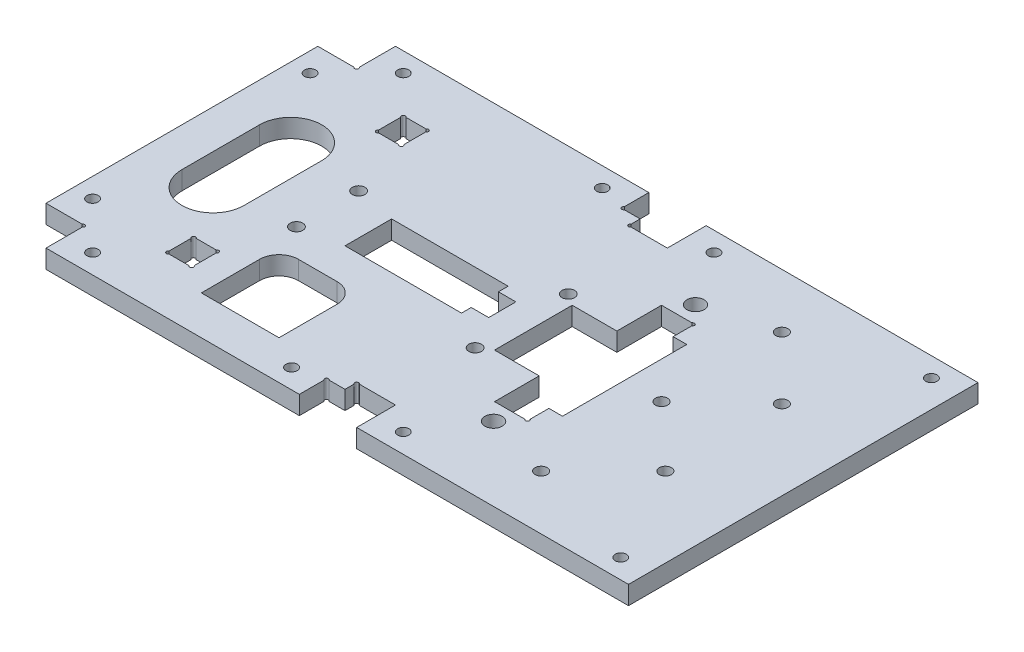
from build123d import *

# Parameters (mm, degrees)
BOSS_EXTRUDE1_DEPTH = 4.7625
MIRROR1_START       = -80
MIRROR1_OUTLINE_W   = 4.7625
MIRROR1_OUTLINE_H   = 35
MIRROR1_DEPTH       = 160
MIRROR1_START_2     = 10
MIRROR1_2_OUTLINE_W = 4.7625
MIRROR1_2_OUTLINE_H = 10
MIRROR1_2_DEPTH     = 70
MIRROR1_START_3     = -70
MIRROR1_3_OUTLINE_W = 4.7625
MIRROR1_3_OUTLINE_H = 10
MIRROR1_3_DEPTH     = 65.2375
MIRROR1_START_4     = -4.7625
MIRROR1_4_OUTLINE_W = 4.7625
MIRROR1_4_OUTLINE_H = 3
MIRROR1_4_DEPTH     = 4.7625
SKETCH2_R           = 1.625
SKETCH2_W           = 14
SKETCH2_H           = 3
SKETCH2_W_2         = 20
SKETCH2_H_2         = 20
CUT_EXTRUDE1_DEPTH  = 92.911269202
SKETCH3_W           = 6.5
SKETCH3_H           = 7
CUT_EXTRUDE2_DEPTH  = 92.911269202
SKETCH4_R           = 2.225
CUT_EXTRUDE3_DEPTH  = 92.911269202
SKETCH5_R           = 1.5625
CUT_EXTRUDE4_DEPTH  = 92.911269202
CUT_EXTRUDE5_DEPTH  = 92.911269202
SKETCH7_R           = 0.5
CUT_EXTRUDE6_DEPTH  = 92.911269202
SKETCH8_R           = 1.45
CUT_EXTRUDE7_DEPTH  = 92.911269202
FILLET1_R           = 5


# Read off the part's stored shape, not the designer's step: Mirror1
with BuildPart() as part:
    # Sketch1 → Boss-Extrude1 (new body)
    with BuildSketch(Plane(origin=(0, 0, 0), x_dir=(1, 0, 0), z_dir=(0, 1, 0))):
        Polygon((-80, 0), (80, 0), (80, -45), (10, -45), (10, -35), (0, -35), (0, -38), (-4.7625, -38), (-4.7625, -45), (-70, -45), (-70, -35), (-80, -35), align=None)
    extrude(amount=BOSS_EXTRUDE1_DEPTH)

    # Mirror1 outline → Mirror1 (add)
    with BuildSketch(Plane.YZ.offset(MIRROR1_START)):
        with Locations((2.38125, -17.5)):
            Rectangle(MIRROR1_OUTLINE_W, MIRROR1_OUTLINE_H)
    extrude(amount=MIRROR1_DEPTH)

    # Mirror1 2 outline → Mirror1 2 (add)
    with BuildSketch(Plane.YZ.offset(MIRROR1_START_2)):
        with Locations((2.38125, -40)):
            Rectangle(MIRROR1_2_OUTLINE_W, MIRROR1_2_OUTLINE_H)
    extrude(amount=MIRROR1_2_DEPTH)

    # Mirror1 3 outline → Mirror1 3 (add)
    with BuildSketch(Plane.YZ.offset(MIRROR1_START_3)):
        with Locations((2.38125, -40)):
            Rectangle(MIRROR1_3_OUTLINE_W, MIRROR1_3_OUTLINE_H)
    extrude(amount=MIRROR1_3_DEPTH)

    # Mirror1 4 outline → Mirror1 4 (add)
    with BuildSketch(Plane.YZ.offset(MIRROR1_START_4)):
        with Locations((2.38125, -36.5)):
            Rectangle(MIRROR1_4_OUTLINE_W, MIRROR1_4_OUTLINE_H)
    extrude(amount=MIRROR1_4_DEPTH)

    # Sketch2 → Cut-Extrude1 (cut, through all)
    with BuildSketch(Plane(origin=(0, 4.7625, 0), x_dir=(1, 0, 0), z_dir=(0, 1, 0))):
        with Locations(Location((7.5, -12, 0), (0, 0, 270))):
            Circle(SKETCH2_R)
        with Locations(Location((7.5, 12, 0), (0, 0, 270))):
            Circle(SKETCH2_R)
        with Locations(Location((-42.5, 8, 0), (0, 0, 270))):
            Circle(SKETCH2_R)
        with Locations(Location((-42.5, -8, 0), (0, 0, 270))):
            Circle(SKETCH2_R)
        Polygon((-2, -3.5), (-2, -6), (-32, -6), (-32, 6), (-2, 6), (-2, 3.5), (2.5, 3.5), (2.5, -3.5), align=None)
        with Locations((19.5, 7.5)):
            Rectangle(SKETCH2_W, SKETCH2_H)
        with Locations((19.5, -7.5)):
            Rectangle(SKETCH2_W, SKETCH2_H)
        with Locations((-30, -25)):
            Rectangle(SKETCH2_W_2, SKETCH2_H_2)
    extrude(amount=-CUT_EXTRUDE1_DEPTH, mode=Mode.SUBTRACT)

    # Sketch3 → Cut-Extrude2 (cut, through all)
    with BuildSketch(Plane(origin=(0, 4.7625, 0), x_dir=(1, 0, 0), z_dir=(0, 1, 0))):
        with Locations((-50.25, 27)):
            Rectangle(SKETCH3_W, SKETCH3_H)
        with Locations((-50.25, -27)):
            Rectangle(SKETCH3_W, SKETCH3_H)
    extrude(amount=-CUT_EXTRUDE2_DEPTH, mode=Mode.SUBTRACT)

    # Sketch4 → Cut-Extrude3 (cut, through all)
    with BuildSketch(Plane(origin=(0, 4.7625, 0), x_dir=(1, 0, 0), z_dir=(0, 1, 0))):
        with Locations(Location((26.25, 26, 0), (0, 0, 270))):
            Circle(SKETCH4_R)
        with Locations(Location((26.25, -26, 0), (0, 0, 270))):
            Circle(SKETCH4_R)
        Polygon((22, -21.5), (30.5, -21.5), (30.5, -16), (34, -16), (34, 16), (30.5, 16), (30.5, 21.5), (22, 21.5), (22, 10), (10.5, 10), (10.5, -10), (22, -10), align=None)
    extrude(amount=-CUT_EXTRUDE3_DEPTH, mode=Mode.SUBTRACT)

    # Sketch5 → Cut-Extrude4 (cut, through all)
    with BuildSketch(Plane(origin=(0, 4.7625, 0), x_dir=(1, 0, 0), z_dir=(0, 1, 0))):
        with Locations(Location((43.5, -31, 0), (0, 0, 270))):
            Circle(SKETCH5_R)
        with Locations(Location((43.5, 0, 0), (0, 0, 270))):
            Circle(SKETCH5_R)
        with Locations(Location((43.5, 31, 0), (0, 0, 270))):
            Circle(SKETCH5_R)
        with Locations(Location((59.5, 15, 0), (0, 0, 270))):
            Circle(SKETCH5_R)
        with Locations(Location((59.5, -15, 0), (0, 0, 270))):
            Circle(SKETCH5_R)
    extrude(amount=-CUT_EXTRUDE4_DEPTH, mode=Mode.SUBTRACT)

    # Sketch6 → Cut-Extrude5 (cut, through all)
    with BuildSketch(Plane(origin=(0, 4.7625, 0), x_dir=(1, 0, 0), z_dir=(0, 1, 0))):
        with BuildLine():
            Line((-54, 10), (-54, -10))
            ThreePointArc((-54, -10), (-62, -18), (-70, -10))
            Line((-70, -10), (-70, 10))
            ThreePointArc((-70, 10), (-62, 18), (-54, 10))
        make_face()
    extrude(amount=-CUT_EXTRUDE5_DEPTH, mode=Mode.SUBTRACT)

    # Sketch7 → Cut-Extrude6 (cut, through all)
    with BuildSketch(Plane(origin=(0, 4.7625, 0), x_dir=(1, 0, 0), z_dir=(0, 1, 0))):
        with Locations((-70.25, -35.25)):
            Circle(SKETCH7_R)
        with Locations((-4.5125, -38.25)):
            Circle(SKETCH7_R)
        with Locations((0.25, -35.25)):
            Circle(SKETCH7_R)
        with Locations((-47.25, -30.25)):
            Circle(SKETCH7_R)
        with Locations((-53.25, -30.25)):
            Circle(SKETCH7_R)
        with Locations((-53.25, -23.75)):
            Circle(SKETCH7_R)
        with Locations((-47.25, -23.75)):
            Circle(SKETCH7_R)
        with Locations((30.25, -21.25)):
            Circle(SKETCH7_R)
        with Locations((30.25, 21.25)):
            Circle(SKETCH7_R)
        with Locations((0.25, 35.25)):
            Circle(SKETCH7_R)
        with Locations((-4.5125, 38.25)):
            Circle(SKETCH7_R)
        with Locations((-53.25, 30.25)):
            Circle(SKETCH7_R)
        with Locations((-47.25, 30.25)):
            Circle(SKETCH7_R)
        with Locations((-47.25, 23.75)):
            Circle(SKETCH7_R)
        with Locations((-53.25, 23.75)):
            Circle(SKETCH7_R)
        with Locations((-70.25, 35.25)):
            Circle(SKETCH7_R)
    extrude(amount=-CUT_EXTRUDE6_DEPTH, mode=Mode.SUBTRACT)

    # Sketch8 → Cut-Extrude7 (cut, through all)
    with BuildSketch(Plane(origin=(0, 4.7625, 0), x_dir=(1, 0, 0), z_dir=(0, 1, 0))):
        with Locations(Location((-75, -28, 0), (0, 0, 270))):
            Circle(SKETCH8_R)
        with Locations(Location((-63, -40, 0), (0, 0, 270))):
            Circle(SKETCH8_R)
        with Locations(Location((-11.7625, -40, 0), (0, 0, 270))):
            Circle(SKETCH8_R)
        with Locations(Location((17, -40, 0), (0, 0, 270))):
            Circle(SKETCH8_R)
        with Locations(Location((73, -40, 0), (0, 0, 270))):
            Circle(SKETCH8_R)
        with Locations(Location((73, 40, 0), (0, 0, 270))):
            Circle(SKETCH8_R)
        with Locations(Location((17, 40, 0), (0, 0, 270))):
            Circle(SKETCH8_R)
        with Locations(Location((-11.7625, 40, 0), (0, 0, 270))):
            Circle(SKETCH8_R)
        with Locations(Location((-63, 40, 0), (0, 0, 270))):
            Circle(SKETCH8_R)
        with Locations(Location((-75, 28, 0), (0, 0, 270))):
            Circle(SKETCH8_R)
    extrude(amount=-CUT_EXTRUDE7_DEPTH, mode=Mode.SUBTRACT)

    # Fillet1
    fillet1_edges = [part.edges().sort_by_distance(p)[0] for p in [
        (-40, 2.38125, 15),
        (-20, 2.38125, 15),
    ]]
    fillet(fillet1_edges, radius=FILLET1_R)


solid = part.part
